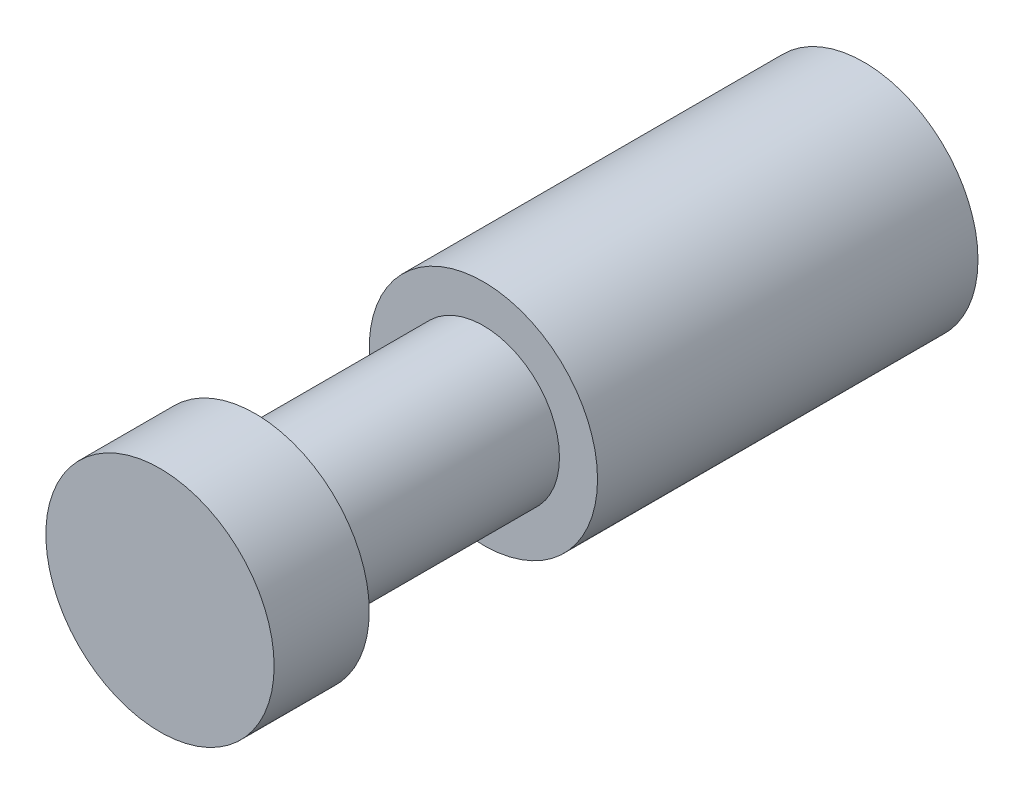
from build123d import *

# Parameters (mm, degrees)
SKETCH1_R           = 6
SKETCH1_R_2         = 4.4
BOSS_EXTRUDE1_DEPTH = 12
SKETCH2_R           = 6
BOSS_EXTRUDE2_DEPTH = 2
SKETCH3_R           = 4
BOSS_EXTRUDE3_DEPTH = 18
SKETCH4_R           = 6
BOSS_EXTRUDE4_DEPTH = 5
SKETCH5_R           = 6
BOSS_EXTRUDE5_DEPTH = 6


with BuildPart() as part:
    # Sketch1 → Boss-Extrude1 (new body)
    with BuildSketch(Plane.XY):
        Circle(SKETCH1_R)
        Circle(SKETCH1_R_2, mode=Mode.SUBTRACT)
    extrude(amount=BOSS_EXTRUDE1_DEPTH)

    # Sketch2 → Boss-Extrude2 (add)
    with BuildSketch(Plane.XY.offset(12)):
        Circle(SKETCH2_R)
    extrude(amount=BOSS_EXTRUDE2_DEPTH)

    # Sketch3 → Boss-Extrude3 (add)
    with BuildSketch(Plane.XY.offset(14)):
        Circle(SKETCH3_R)
    extrude(amount=BOSS_EXTRUDE3_DEPTH)

    # Sketch4 → Boss-Extrude4 (add)
    with BuildSketch(Plane.XY.offset(32)):
        Circle(SKETCH4_R)
    extrude(amount=BOSS_EXTRUDE4_DEPTH)

    # Sketch5 → Boss-Extrude5 (add)
    with BuildSketch(Plane.XY.offset(14)):
        Circle(SKETCH5_R)
    extrude(amount=BOSS_EXTRUDE5_DEPTH)


solid = part.part
